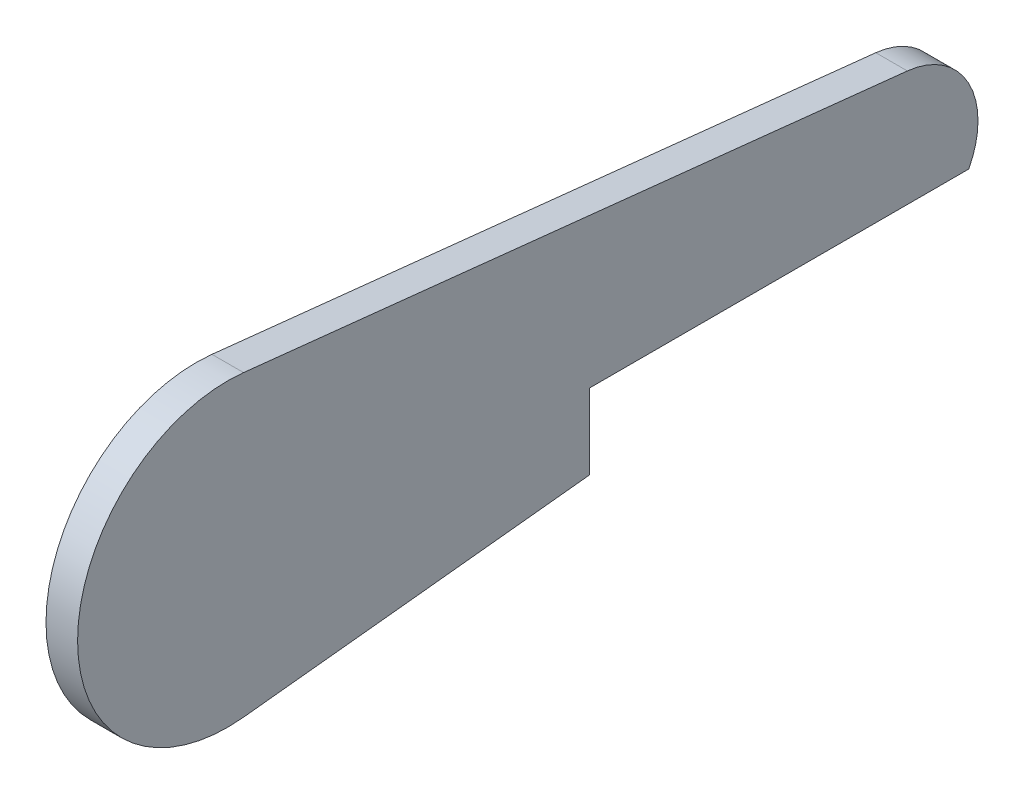
from build123d import *

# Parameters (mm, degrees)
DODANIE_WYCI_GNI_CIE1_DEPTH = 5
DODANIE_WYCI_GNI_CIE2_START = 15
DODANIE_WYCI_GNI_CIE2_DEPTH = 15
SZKIC3_R                    = 10.56077606
SZKIC3_R_2                  = 15.572635527
DODANIE_WYCI_GNI_CIE3_DEPTH = 2
WYTNIJ_WYCI_GNI_CIE1_START  = -20
WYTNIJ_WYCI_GNI_CIE1_DEPTH  = 20


with BuildPart() as part:
    # Szkic1 → Dodanie-wyciągnięcie1 (new body)
    with BuildSketch(Plane(origin=(0, 0, 0), x_dir=(0, 0, -1), z_dir=(1, 0, 0))):
        with BuildLine():
            Line((10.058823529, 94.465973076), (430.294117647, 49.718933198))
            ThreePointArc((430.294117647, 49.718933198), (475, 0), (430.294117647, -49.718933198))
            Line((430.294117647, -49.718933198), (10.058823529, -94.465973076))
            ThreePointArc((10.058823529, -94.465973076), (-95, 0), (10.058823529, 94.465973076))
        make_face()
    extrude(amount=DODANIE_WYCI_GNI_CIE1_DEPTH)

    # Szkic2 → Dodanie-wyciągnięcie2 (add)
    with BuildSketch(Plane.ZY.offset(DODANIE_WYCI_GNI_CIE2_START)):
        with BuildLine():
            Line((-10.058823529, 94.465973076), (-430.294117647, 49.718933198))
            ThreePointArc((-430.294117647, 49.718933198), (-475, 0), (-430.294117647, -49.718933198))
            Line((-430.294117647, -49.718933198), (-10.058823529, -94.465973076))
            ThreePointArc((-10.058823529, -94.465973076), (95, 0), (-10.058823529, 94.465973076))
        make_face()
        with BuildLine():
            Line((-9.529411765, 89.494079756), (-429.764705882, 44.747039878))
            ThreePointArc((-429.764705882, 44.747039878), (-470, 0), (-429.764705882, -44.747039878))
            Line((-429.764705882, -44.747039878), (-9.529411765, -89.494079756))
            ThreePointArc((-9.529411765, -89.494079756), (90, 0), (-9.529411765, 89.494079756))
        make_face(mode=Mode.SUBTRACT)
    extrude(amount=-DODANIE_WYCI_GNI_CIE2_DEPTH)

    # Szkic3 → Dodanie-wyciągnięcie3 (add)
    with BuildSketch(Plane.ZY):
        with Locations((-425, 0)):
            Circle(SZKIC3_R)
        Circle(SZKIC3_R_2)
    extrude(amount=DODANIE_WYCI_GNI_CIE3_DEPTH)

    # Szkic4 → Wytnij-wyciągnięcie1 (cut)
    with BuildSketch(Plane(origin=(5, 0, 0), x_dir=(0, 0, -1), z_dir=(1, 0, 0)).offset(WYTNIJ_WYCI_GNI_CIE1_START)):
        with BuildLine():
            ThreePointArc((430.294117647, -49.718933198), (452.973624228, -41.442446206), (469.131245302, -23.503897297))
            Line((469.131245302, -23.503897297), (229.084460246, -23.503897297))
            Line((229.084460246, -23.503897297), (229.084460246, -71.143922221))
            Line((229.084460246, -71.143922221), (430.294117647, -49.718933198))
        make_face()
    extrude(amount=WYTNIJ_WYCI_GNI_CIE1_DEPTH, mode=Mode.SUBTRACT)


solid = part.part
